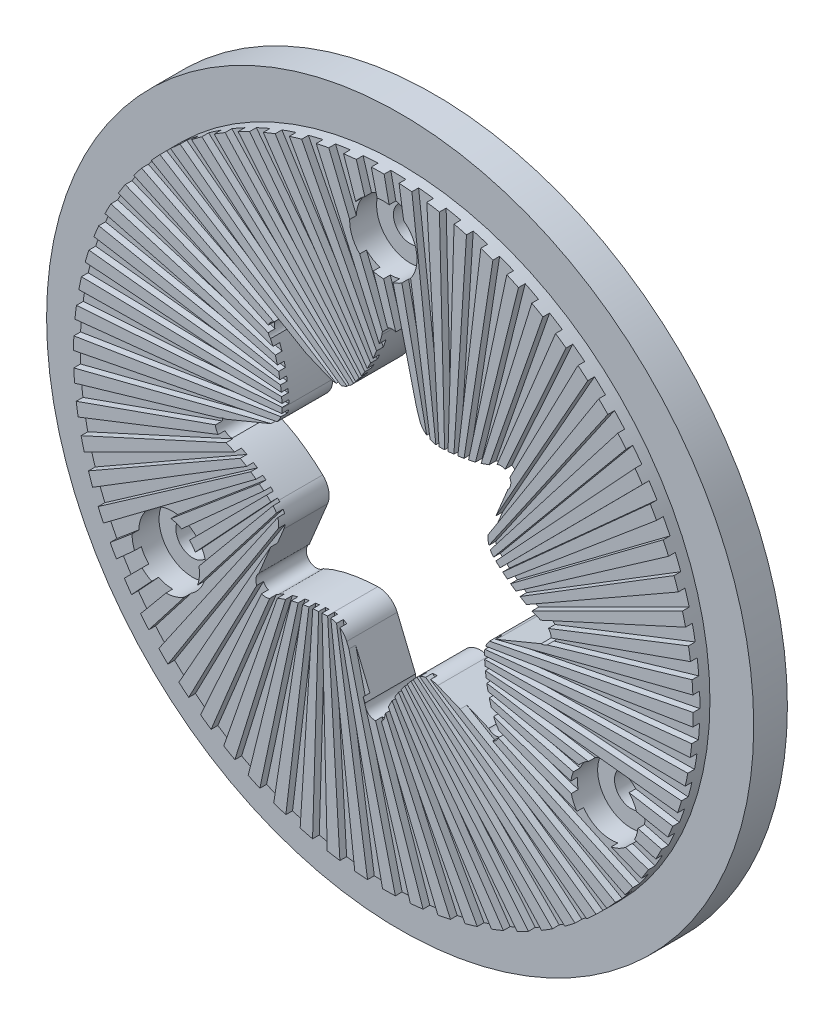
from build123d import *

# Parameters (mm, degrees)
CROQUIS1_R              = 52.5
SALIENTE_EXTRUIR1_DEPTH = 5
SALIENTE_EXTRUIR2_DEPTH = 2.5
MATRIZC1_COUNT          = 70
CROQUIS3_R              = 46
SALIENTE_EXTRUIR3_DEPTH = 1.5
CROQUIS6_R              = 5
CORTAR_EXTRUIR4_DEPTH   = 4
CORTAR_EXTRUIR3_DEPTH   = 45.25
CROQUIS7_R              = 2.5
CORTAR_EXTRUIR5_DEPTH   = 75.624057934


with BuildPart() as part:
    # Croquis1 → Saliente-Extruir1 (new body)
    with BuildSketch(Plane.XY):
        Circle(CROQUIS1_R)
    extrude(amount=SALIENTE_EXTRUIR1_DEPTH)

    # Croquis2 → Saliente-Extruir2 (add)
    with BuildSketch(Plane.XY.offset(5)):
        with BuildLine():
            ThreePointArc((-19.854208193, 41.494703482), (-20.708493648, 41.075032451), (-21.553913133, 40.637775882))
            Line((-21.553913133, 40.637775882), (-1.461439192, 16.184149514))
            ThreePointArc((-1.461439192, 16.184149514), (-0.981150583, 16.220352756), (-0.5, 16.242305871))
            Line((-0.5, 16.242305871), (-19.854208193, 41.494703482))
        make_face()
    saliente_extruir2 = extrude(amount=SALIENTE_EXTRUIR2_DEPTH)

    # MatrizC1: Saliente-Extruir2 ×70 about axis
    matrizc1_axis = Axis((0, 0, 5), (0, 0, -1))
    for i in range(1, MATRIZC1_COUNT):
        add(saliente_extruir2.rotate(matrizc1_axis, i * 360 / MATRIZC1_COUNT))

    # Croquis3 → Saliente-Extruir3 (add)
    with BuildSketch(Plane.XY.offset(5)):
        Circle(CROQUIS3_R)
    extrude(amount=SALIENTE_EXTRUIR3_DEPTH)

    # Croquis6 → Cortar-Extruir4 (cut)
    with BuildSketch(Plane.XY.offset(7.5)):
        with Locations((0, 37.5)):
            Circle(CROQUIS6_R)
        with Locations((32.824827041, -18.74837712)):
            Circle(CROQUIS6_R)
        with Locations((-32.300109987, -19.051322653)):
            Circle(CROQUIS6_R)
    extrude(amount=-CORTAR_EXTRUIR4_DEPTH, mode=Mode.SUBTRACT)

    # Croquis5 → Cortar-Extruir3 (cut, symmetric)
    with BuildSketch(Plane.XY.offset(5)):
        with BuildLine():
            Line((14.646202513, -18.493062589), (8.07920159, -15.772921743))
            ThreePointArc((8.07920159, -15.772921743), (6.291160974, -15.61361981), (4.732270055, -16.503746459))
            add(Edge.make_bspline(
                [(0.233051158, -23.450807424), (1.021762834, -21.201431834), (2.521502466, -18.885744845), (4.732270055, -16.503746459)],
                knots=[0.452649767, 0.452649767, 0.452649767, 0.452649767, 0.905299533, 0.905299533, 0.905299533, 0.905299533], degree=3))
            ThreePointArc((0.233051158, -23.450807424), (-1.252449017, -24.918499253), (-2.720140846, -23.432999077))
            Line((-2.720140846, -23.432999077), (-5.440281693, -16.865998155))
            ThreePointArc((-5.440281693, -16.865998155), (-6.59197386, -15.489019033), (-8.32369079, -15.016131282))
            add(Edge.make_bspline(
                [(-16.417432899, -16.747017008), (-14.269180792, -15.714171649), (-11.571266755, -15.137209741), (-8.32369079, -15.016131282)],
                knots=[0.452649767, 0.452649767, 0.452649767, 0.452649767, 0.905299533, 0.905299533, 0.905299533, 0.905299533], degree=3))
            ThreePointArc((-16.417432899, -16.747017008), (-18.505654992, -16.734424605), (-18.493062589, -14.646202513))
            Line((-18.493062589, -14.646202513), (-15.772921743, -8.07920159))
            ThreePointArc((-15.772921743, -8.07920159), (-15.61361981, -6.291160974), (-16.503746459, -4.732270055))
            add(Edge.make_bspline(
                [(-23.450807424, -0.233051158), (-21.201431834, -1.021762834), (-18.885744845, -2.521502466), (-16.503746459, -4.732270055)],
                knots=[0.452649767, 0.452649767, 0.452649767, 0.452649767, 0.905299533, 0.905299533, 0.905299533, 0.905299533], degree=3))
            ThreePointArc((-23.450807424, -0.233051158), (-24.918499253, 1.252449017), (-23.432999077, 2.720140846))
            Line((-23.432999077, 2.720140846), (-16.865998155, 5.440281693))
            ThreePointArc((-16.865998155, 5.440281693), (-15.489019033, 6.59197386), (-15.016131282, 8.32369079))
            add(Edge.make_bspline(
                [(-16.747017008, 16.417432899), (-15.714171649, 14.269180792), (-15.137209741, 11.571266755), (-15.016131282, 8.32369079)],
                knots=[0.452649767, 0.452649767, 0.452649767, 0.452649767, 0.905299533, 0.905299533, 0.905299533, 0.905299533], degree=3))
            ThreePointArc((-16.747017008, 16.417432899), (-16.734424606, 18.505654992), (-14.646202513, 18.493062589))
            Line((-14.646202513, 18.493062589), (-8.07920159, 15.772921743))
            ThreePointArc((-8.07920159, 15.772921743), (-6.291160974, 15.61361981), (-4.732270055, 16.503746459))
            add(Edge.make_bspline(
                [(-0.188968018, 25.206434257), (-1.021079102, 22.137517894), (-2.521502466, 18.885744845), (-4.732270055, 16.503746459)],
                knots=[0.452649767, 0.452649767, 0.452649767, 0.452649767, 0.905299533, 0.905299533, 0.905299533, 0.905299533], degree=3))
            ThreePointArc((-0.188968018, 25.206434257), (1.296532158, 26.674126086), (2.764223987, 25.188625911))
            Line((2.764223987, 25.188625911), (5.354850339, 17.099088728))
            ThreePointArc((5.354850339, 17.099088728), (6.48888657, 15.558207496), (8.32369079, 15.016131282))
            add(Edge.make_bspline(
                [(16.417432899, 16.747017008), (14.269180792, 15.714171649), (11.571266755, 15.137209741), (8.32369079, 15.016131282)],
                knots=[0.452649767, 0.452649767, 0.452649767, 0.452649767, 0.905299533, 0.905299533, 0.905299533, 0.905299533], degree=3))
            ThreePointArc((16.417432899, 16.747017008), (18.505654992, 16.734424606), (18.493062589, 14.646202513))
            Line((18.493062589, 14.646202513), (15.772921743, 8.07920159))
            ThreePointArc((15.772921743, 8.07920159), (15.61361981, 6.291160974), (16.503746459, 4.732270055))
            add(Edge.make_bspline(
                [(23.450807424, 0.233051158), (21.201431834, 1.021762834), (18.885744845, 2.521502466), (16.503746459, 4.732270055)],
                knots=[0.452649767, 0.452649767, 0.452649767, 0.452649767, 0.905299533, 0.905299533, 0.905299533, 0.905299533], degree=3))
            ThreePointArc((23.450807424, 0.233051158), (24.918499253, -1.252449017), (23.432999077, -2.720140846))
            Line((23.432999077, -2.720140846), (16.865998155, -5.440281693))
            ThreePointArc((16.865998155, -5.440281693), (15.489019033, -6.59197386), (15.016131282, -8.32369079))
            add(Edge.make_bspline(
                [(16.747017008, -16.417432899), (15.714171649, -14.269180792), (15.137209741, -11.571266755), (15.016131282, -8.32369079)],
                knots=[0.452649767, 0.452649767, 0.452649767, 0.452649767, 0.905299533, 0.905299533, 0.905299533, 0.905299533], degree=3))
            ThreePointArc((16.747017008, -16.417432899), (16.734424605, -18.505654992), (14.646202513, -18.493062589))
        make_face()
    extrude(amount=CORTAR_EXTRUIR3_DEPTH, both=True, mode=Mode.SUBTRACT)

    # Croquis7 → Cortar-Extruir5 (cut, through all)
    with BuildSketch(Plane(origin=(0, 0, 0), x_dir=(-1, 0, 0), z_dir=(0, 0, -1))):
        with Locations((0, 37.5)):
            Circle(CROQUIS7_R)
        with Locations((32.300109987, -19.051322653)):
            Circle(CROQUIS7_R)
        with Locations((-32.824827041, -18.74837712)):
            Circle(CROQUIS7_R)
    extrude(amount=-CORTAR_EXTRUIR5_DEPTH, mode=Mode.SUBTRACT)


solid = part.part
